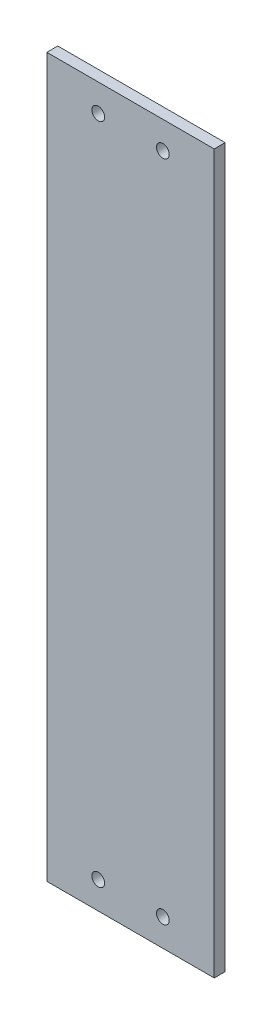
from build123d import *

# Parameters (mm, degrees)
SKETCH1_W             = 24.32
SKETCH1_H             = 104.33
BOSS_EXTRUDE1_DEPTH   = 1.5875
F_0_CLEARANCE_HOLE1_D = 1.8542


with BuildPart() as part:
    # Sketch1 → Boss-Extrude1 (new body)
    with BuildSketch(Plane.XY):
        with Locations((-92.71, -61.849)):
            Rectangle(SKETCH1_W, SKETCH1_H)
    extrude(amount=BOSS_EXTRUDE1_DEPTH)

    # #0 Clearance Hole1 (through all)
    with Locations(Plane.XY.offset(1.5875)):
        with Locations((-88.011, -110.0455), (-97.409, -110.0455), (-88.011, -13.6525), (-97.409, -13.6525)):
            Hole(F_0_CLEARANCE_HOLE1_D / 2)


solid = part.part
